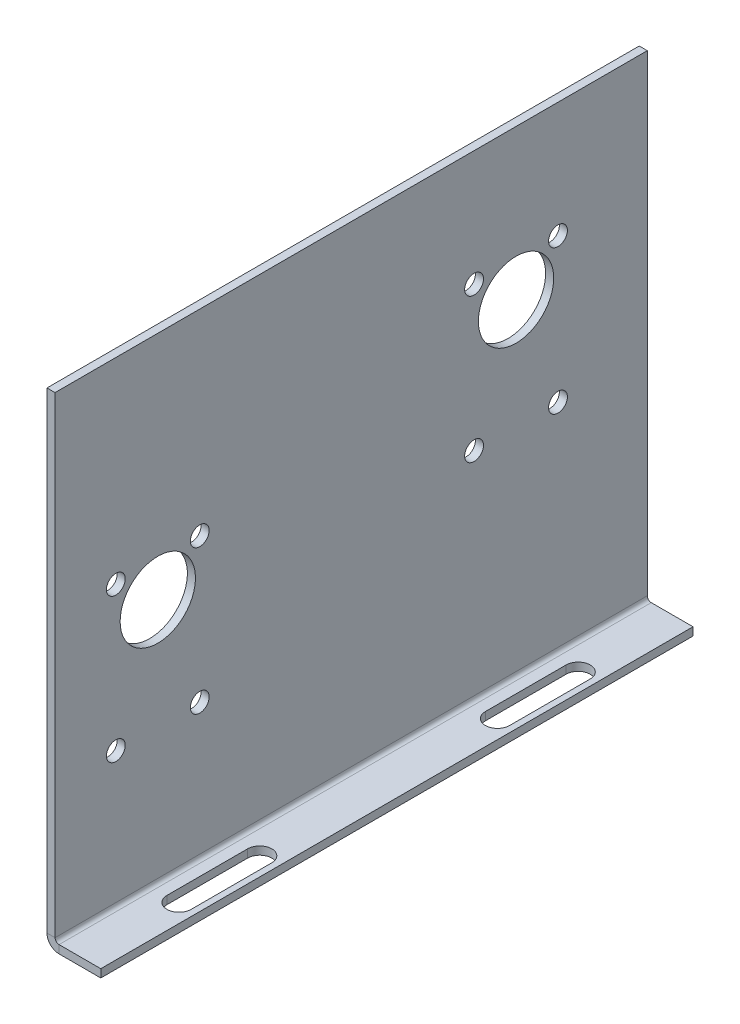
from build123d import *

# Parameters (mm, degrees)
SKETCH_1_W                       = 1.5
SKETCH_1_H                       = 90
SM_BASE_FLANGE_1_DEPTH           = 110.1
SKETCH_6_R                       = 7
SKETCH_6_R_2                     = 1.75
CUT_EXTRUDE_1_DEPTH              = 10
SM_EDGE_FLANGE_1_STRIP_W         = 7.4732
SM_EDGE_FLANGE_1_STRIP_H         = 1.5
SM_EDGE_FLANGE_1_STRIP_CUT_DEPTH = 110.1
SM_EDGE_FLANGE_1_DEPTH           = 110.1
CUT_EXTRUDE_2_DEPTH              = 10


# Sheet-metal steps are written as plain solids
with BuildPart() as part:
    # Sketch 1 → 基体-法兰1 (new body)
    with BuildSketch(Plane.XY):
        with Locations((0.75, 45)):
            Rectangle(SKETCH_1_W, SKETCH_1_H)
    extrude(amount=SM_BASE_FLANGE_1_DEPTH)

    # 草图6 → 切除-拉伸1 (cut)
    with BuildSketch(Plane.ZY):
        with Locations((24.4, 62.1)):
            Circle(SKETCH_6_R)
        with Locations((91, 47.1)):
            Circle(SKETCH_6_R)
        with Locations((16.6, 68.5)):
            Circle(SKETCH_6_R_2)
        with Locations((16.6, 41.7)):
            Circle(SKETCH_6_R_2)
        with Locations((32.2, 41.7)):
            Circle(SKETCH_6_R_2)
        with Locations((32.2, 68.5)):
            Circle(SKETCH_6_R_2)
        with Locations((83.2, 53.5)):
            Circle(SKETCH_6_R_2)
        with Locations((83.2, 26.7)):
            Circle(SKETCH_6_R_2)
        with Locations((98.8, 26.7)):
            Circle(SKETCH_6_R_2)
        with Locations((98.8, 53.5)):
            Circle(SKETCH_6_R_2)
    extrude(amount=-CUT_EXTRUDE_1_DEPTH, mode=Mode.SUBTRACT)

    # 边线-法兰1 strip (across the edge) → 边线-法兰1 strip cut (cut)
    with BuildSketch(Plane(origin=(1.5, 0, 110.1), x_dir=(0, 1, 0), z_dir=(0, 0, -1))):
        with Locations((-1.5, -0.75)):
            Rectangle(SM_EDGE_FLANGE_1_STRIP_W, SM_EDGE_FLANGE_1_STRIP_H)
    extrude(amount=SM_EDGE_FLANGE_1_STRIP_CUT_DEPTH, mode=Mode.SUBTRACT)

    # 边线-法兰1 section (across the edge) → 边线-法兰1 (add)
    with BuildSketch(Plane(origin=(1.5, 0, 110.1), x_dir=(0, 1, 0), z_dir=(0, 0, -1))):
        with BuildLine():
            Line((0, 0.7366), (0, 8.5))
            Line((0, 8.5), (1.5, 8.5))
            Line((1.5, 8.5), (1.5, 0.7366))
            ThreePointArc((1.5, 0.7366), (1.715745145, 0.215745145), (2.2366, 0))
            Line((2.2366, 0), (2.2366, -1.5))
            ThreePointArc((2.2366, -1.5), (0.655084973, -0.844915027), (0, 0.7366))
        make_face()
    extrude(amount=SM_EDGE_FLANGE_1_DEPTH)

    # 草图10 → 切除-拉伸2 (cut)
    with BuildSketch(Plane(origin=(0, 1.5, 0), x_dir=(1, 0, 0), z_dir=(0, 1, 0))):
        with BuildLine():
            Line((8.85, -17.95), (8.85, -32.95))
            ThreePointArc((8.85, -32.95), (6.6, -35.2), (4.35, -32.95))
            Line((4.35, -32.95), (4.35, -17.95))
            ThreePointArc((4.35, -17.95), (6.6, -15.700000154), (8.85, -17.95))
        make_face()
        with BuildLine():
            Line((4.35, -92.15), (4.35, -77.15))
            ThreePointArc((4.35, -77.15), (6.6, -74.899999913), (8.85, -77.15))
            Line((8.85, -77.15), (8.85, -92.15))
            ThreePointArc((8.85, -92.15), (6.6, -94.4), (4.35, -92.15))
        make_face()
    extrude(amount=-CUT_EXTRUDE_2_DEPTH, mode=Mode.SUBTRACT)


solid = part.part
